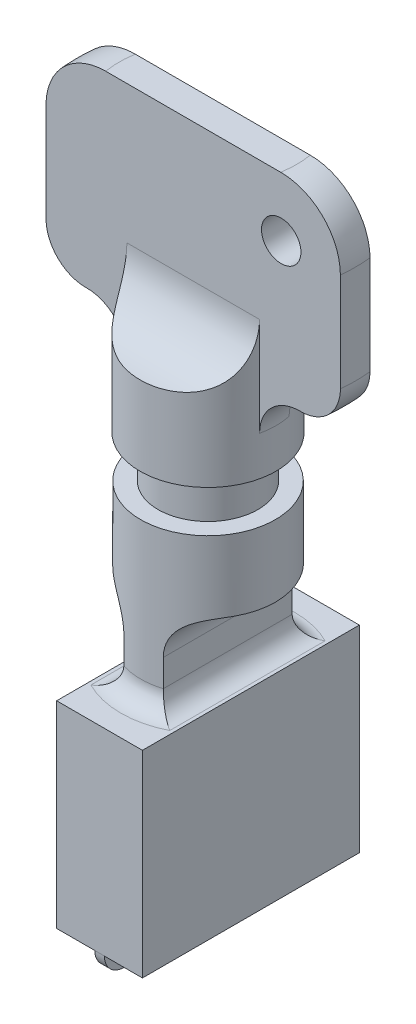
from build123d import *

# Parameters (mm, degrees)
BOSS_EXTRUDE1_DEPTH      = 10
FILLET2_R                = 2
FILLET3_R                = 3
CUT_EXTRUDE1_DEPTH       = 49.473897211
CUT_EXTRUDE1_DEPTH_BACK  = 49.473897211
SKETCH3_R                = 1
CUT_EXTRUDE2_DEPTH       = 49.473897211
CUT_EXTRUDE2_DEPTH_BACK  = 49.473897211
SKETCH4_W                = 5.555619824
SKETCH4_H                = 11.886700215
SKETCH4_W_2              = 4.837610552
SKETCH4_H_2              = 13.886700215
FILLET4_R                = 2
BOSS_EXTRUDE2_DEPTH      = 5.5
BOSS_EXTRUDE2_DEPTH_BACK = 5.5
SKETCH7_W                = 4.35
SKETCH7_H                = 10
FILLET5_R                = 1
SKETCH8_W                = 0.486068648
SKETCH8_H                = 11
BOSS_EXTRUDE3_DEPTH      = 1
FILLET6_R                = 1


with BuildPart() as part:
    # Sketch1 → Revolve1 (revolve)
    with BuildSketch(Plane.XY):
        Polygon((-3.448914015, 37.765821371), (-3.448914015, 33.765821371), (-2.534753992, 33.765821371), (-2.534753992, 31.624967984), (-3.41766068, 31.624967984), (-3.41766068, 23), (0, 23), (0, 37.765821371), align=None)
    revolve(axis=Axis((0, 37.765821371, 0), (0, -1, 0)))

    # Sketch2 → Boss-Extrude1 (add)
    with BuildSketch(Plane(origin=(0, 37.765821371, 0), x_dir=(1, 0, 0), z_dir=(0, 1, 0))):
        with BuildLine():
            Line((3.366379046, 0.75), (-3.366379046, 0.75))
            ThreePointArc((-3.366379046, 0.75), (-3.448914015, 0), (-3.366379046, -0.75))
            Line((-3.366379046, -0.75), (3.366379046, -0.75))
            ThreePointArc((3.366379046, -0.75), (3.428218178, -0.37726384), (3.448914015, 0))
            ThreePointArc((3.448914015, 0), (3.428218178, 0.37726384), (3.366379046, 0.75))
        make_face()
        with BuildLine():
            Line((-3.366379046, 0.75), (-7.462405778, 0.75))
            ThreePointArc((-7.462405778, 0.75), (-7.5, 0), (-7.462405778, -0.75))
            Line((-7.462405778, -0.75), (-3.366379046, -0.75))
            ThreePointArc((-3.366379046, -0.75), (-3.448914015, 0), (-3.366379046, 0.75))
        make_face()
        with BuildLine():
            ThreePointArc((7.5, 0), (7.490595548, 0.375470813), (7.462405778, 0.75))
            Line((7.462405778, 0.75), (3.366379046, 0.75))
            ThreePointArc((3.366379046, 0.75), (3.428218178, 0.37726384), (3.448914015, 0))
            ThreePointArc((3.448914015, 0), (3.428218178, -0.37726384), (3.366379046, -0.75))
            Line((3.366379046, -0.75), (7.462405778, -0.75))
            ThreePointArc((7.462405778, -0.75), (7.490595548, -0.375470813), (7.5, 0))
        make_face()
    extrude(amount=BOSS_EXTRUDE1_DEPTH)

    # Fillet2
    # the kernel refuses this fillet: 2 mm, written as the material it adds along each edge
    with BuildSketch(Plane(origin=(0, 37.765821371, 0), x_dir=(-0.09803421101524086, 0, -0.9951830452085783), z_dir=(-0.9951830452085783, 0, 0.09803421101524086))) as fillet2_piece_1_section:
        with BuildLine():
            CenterArc((3.448914015 + FILLET2_R, FILLET2_R), FILLET2_R, 180, 90)
            Line((3.448914015 + FILLET2_R, 0), (3.448914015, 0))
            Line((3.448914015, 0), (3.448914015, FILLET2_R))
        make_face()
    fillet2_piece_1 = revolve(axis=Axis((0, 37.765821371, 0), (0, -1, 0)), revolution_arc=191.251965623, mode=Mode.PRIVATE)
    fillet2_piece_1 = split(fillet2_piece_1, bisect_by=Plane(origin=(3.870689991, 37.318827735, -0.75), z_dir=(0, 0, 1)), keep=Keep.TOP, mode=Mode.PRIVATE)
    fillet2_piece_1 = split(fillet2_piece_1, bisect_by=Plane(origin=(3.870689991, 37.318827735, 0.75), z_dir=(0, 0, -1)), keep=Keep.TOP, mode=Mode.PRIVATE)
    add(fillet2_piece_1)
    with BuildSketch(Plane(origin=(0, 37.765821371, 0), x_dir=(0.09800035789508027, 0, 0.9951863794548418), z_dir=(0.9951863794548418, 0, -0.09800035789508027))) as fillet2_piece_2_section:
        with BuildLine():
            CenterArc((3.448914015 + FILLET2_R, FILLET2_R), FILLET2_R, 180, 90)
            Line((3.448914015 + FILLET2_R, 0), (3.448914015, 0))
            Line((3.448914015, 0), (3.448914015, FILLET2_R))
        make_face()
    fillet2_piece_2 = revolve(axis=Axis((0, 37.765821371, 0), (0, -1, 0)), revolution_arc=95.624033786, mode=Mode.PRIVATE)
    fillet2_piece_2 = split(fillet2_piece_2, bisect_by=Plane(origin=(-3.870690025, 37.318827894, 0.75), z_dir=(0, 0, -1)), keep=Keep.TOP, mode=Mode.PRIVATE)
    add(fillet2_piece_2)
    with BuildSketch(Plane(origin=(0, 37.765821371, 0), x_dir=(-1, 0, 0), z_dir=(0, 0, 1))) as fillet2_piece_3_section:
        with BuildLine():
            CenterArc((3.448914015 + FILLET2_R, FILLET2_R), FILLET2_R, 180, 90)
            Line((3.448914015 + FILLET2_R, 0), (3.448914015, 0))
            Line((3.448914015, 0), (3.448914015, FILLET2_R))
        make_face()
    fillet2_piece_3 = revolve(axis=Axis((0, 37.765821371, 0), (0, -1, 0)), revolution_arc=95.624033786, mode=Mode.PRIVATE)
    fillet2_piece_3 = split(fillet2_piece_3, bisect_by=Plane(origin=(-3.870689874, 37.318828004, -0.75), z_dir=(0, 0, 1)), keep=Keep.TOP, mode=Mode.PRIVATE)
    add(fillet2_piece_3)
    # the kernel refuses this fillet: 2 mm, written as the material it takes off along each edge
    with BuildSketch(Plane(origin=(0, 37.765821371, 0), x_dir=(-0.7201079494948177, 0, -0.6938620475817721), z_dir=(0.6938620475817721, 0, -0.7201079494948177))) as fillet2_2_piece_1:
        with BuildLine():
            CenterArc((7.5 - FILLET2_R, FILLET2_R), FILLET2_R, 270, 90)
            Line((7.5, FILLET2_R), (7.5, 0))
            Line((7.5, 0), (7.5 - FILLET2_R, 0))
        make_face()
    revolve(axis=Axis((0, 37.765821371, 0), (0, 1, 0)), revolution_arc=87.873212667, mode=Mode.SUBTRACT)
    with BuildSketch(Plane(origin=(0, 37.765821371, 0), x_dir=(0.7201079494948216, 0, 0.6938620475817678), z_dir=(-0.6938620475817678, 0, 0.7201079494948216))) as fillet2_2_piece_2:
        with BuildLine():
            CenterArc((7.5 - FILLET2_R, FILLET2_R), FILLET2_R, 270, 90)
            Line((7.5 - FILLET2_R, 0), (7.5, 0))
            Line((7.5, 0), (7.5, FILLET2_R))
        make_face()
    revolve(axis=Axis((0, 37.765821371, 0), (0, 1, 0)), revolution_arc=87.873212667, mode=Mode.SUBTRACT)

    # Fillet3
    # the kernel refuses this fillet: 3 mm, written as the material it adds along each edge
    with BuildSketch(Plane(origin=(10.866379046, 37.765821371, -0.75), x_dir=(0, 1, 0), z_dir=(-1, 0, 0))) as fillet3_piece_1_section:
        with BuildLine():
            CenterArc((FILLET3_R, FILLET3_R), FILLET3_R, 180, 90)
            Line((0, FILLET3_R), (0, 0))
            Line((0, 0), (FILLET3_R, 0))
        make_face()
    fillet3_piece_1 = extrude(amount=21.732758092, mode=Mode.PRIVATE)
    fillet3_piece_1 = fillet3_piece_1 & Plane(origin=(0, 38.470226203, 0), x_dir=(-1, 0, 0), z_dir=(0, -1, 0)) * Cylinder(3.448914015, 56, mode=Mode.PRIVATE)
    add(fillet3_piece_1)
    with BuildSketch(Plane(origin=(10.866379046, 37.765821371, 0.75), x_dir=(0, 1, 0), z_dir=(-1, 0, 0))) as fillet3_piece_2_section:
        with BuildLine():
            CenterArc((FILLET3_R, -FILLET3_R), FILLET3_R, 90, 90)
            Line((0, -FILLET3_R), (0, 0))
            Line((0, 0), (FILLET3_R, 0))
        make_face()
    fillet3_piece_2 = extrude(amount=21.732758092, mode=Mode.PRIVATE)
    fillet3_piece_2 = fillet3_piece_2 & Plane(origin=(0, 38.470226203, 0), x_dir=(-1, 0, 0), z_dir=(0, -1, 0)) * Cylinder(3.448914015, 56, mode=Mode.PRIVATE)
    add(fillet3_piece_2)
    # the kernel refuses this fillet: 3 mm, written as the material it takes off along each edge
    with BuildSketch(Plane(origin=(0, 47.765821371, 0), x_dir=(-0.4534410859899706, 0, -0.8912862511764871), z_dir=(0.8912862511764871, 0, -0.4534410859899706))) as fillet3_2_piece_1:
        with BuildLine():
            CenterArc((7.5 - FILLET3_R, -FILLET3_R), FILLET3_R, 0, 90)
            Line((7.5 - FILLET3_R, 0), (7.5, 0))
            Line((7.5, 0), (7.5, -FILLET3_R))
        make_face()
    revolve(axis=Axis((0, 47.765821371, 0), (0, 1, 0)), revolution_arc=126.070648523, mode=Mode.SUBTRACT)
    with BuildSketch(Plane(origin=(0, 47.765821371, 0), x_dir=(0.4534410859901425, 0, -0.8912862511763997), z_dir=(-0.8912862511763997, 0, -0.4534410859901425))) as fillet3_2_piece_2:
        with BuildLine():
            CenterArc((7.5 - FILLET3_R, FILLET3_R), FILLET3_R, 270, 90)
            Line((7.5, FILLET3_R), (7.5, 0))
            Line((7.5, 0), (7.5 - FILLET3_R, 0))
        make_face()
    revolve(axis=Axis((0, 47.765821371, 0), (0, -1, 0)), revolution_arc=126.070648523, mode=Mode.SUBTRACT)

    # Sketch3 → Cut-Extrude1 (cut, two sides: drawn at the far end of the back side and taken through both)
    with BuildSketch(Plane.XY.offset(-CUT_EXTRUDE1_DEPTH_BACK)):
        with Locations((4.462405778, 44.765821371)):
            Circle(SKETCH3_R)
    extrude(amount=CUT_EXTRUDE1_DEPTH + CUT_EXTRUDE1_DEPTH_BACK, mode=Mode.SUBTRACT)

    # Sketch4 → Cut-Extrude2 (cut, two sides: drawn at the far end of the back side and taken through both)
    with BuildSketch(Plane.XY.offset(-CUT_EXTRUDE2_DEPTH_BACK)):
        with Locations((-3.777809912, 22.056649893)):
            Rectangle(SKETCH4_W, SKETCH4_H)
        with Locations((3.418805276, 21.056649893)):
            Rectangle(SKETCH4_W_2, SKETCH4_H_2)
    extrude(amount=CUT_EXTRUDE2_DEPTH + CUT_EXTRUDE2_DEPTH_BACK, mode=Mode.SUBTRACT)

    # Fillet4
    fillet4_edges = [part.edges().sort_by_distance(p)[0] for p in [
        (-1, 28, 0),
        (1, 28, 0),
    ]]
    fillet(fillet4_edges, radius=FILLET4_R)

    # Sketch7 → Boss-Extrude2 (add, two sides: drawn at the far end of the back side and taken through both)
    with BuildSketch(Plane.XY.offset(-BOSS_EXTRUDE2_DEPTH_BACK)):
        with Locations((0, 18.624967984)):
            Rectangle(SKETCH7_W, SKETCH7_H)
    extrude(amount=BOSS_EXTRUDE2_DEPTH + BOSS_EXTRUDE2_DEPTH_BACK)

    # Fillet5
    fillet5_edges = [part.edges().sort_by_distance(p)[0] for p in [
        (1, 23.624967984, 0),
        (0, 23.624967984, -3.41766068),
        (0, 23.624967984, 3.41766068),
        (-1, 23.624967984, 0),
    ]]
    fillet(fillet5_edges, radius=FILLET5_R)

    # Sketch8 → Boss-Extrude3 (add)
    with BuildSketch(Plane.XZ.offset(-13.624967984)):
        Rectangle(SKETCH8_W, SKETCH8_H)
    extrude(amount=BOSS_EXTRUDE3_DEPTH)

    # Fillet6
    fillet6_edges = [part.edges().sort_by_distance(p)[0] for p in [
        (0, 12.624967984, -5.5),
        (0, 12.624967984, 5.5),
    ]]
    fillet(fillet6_edges, radius=FILLET6_R)


solid = part.part
